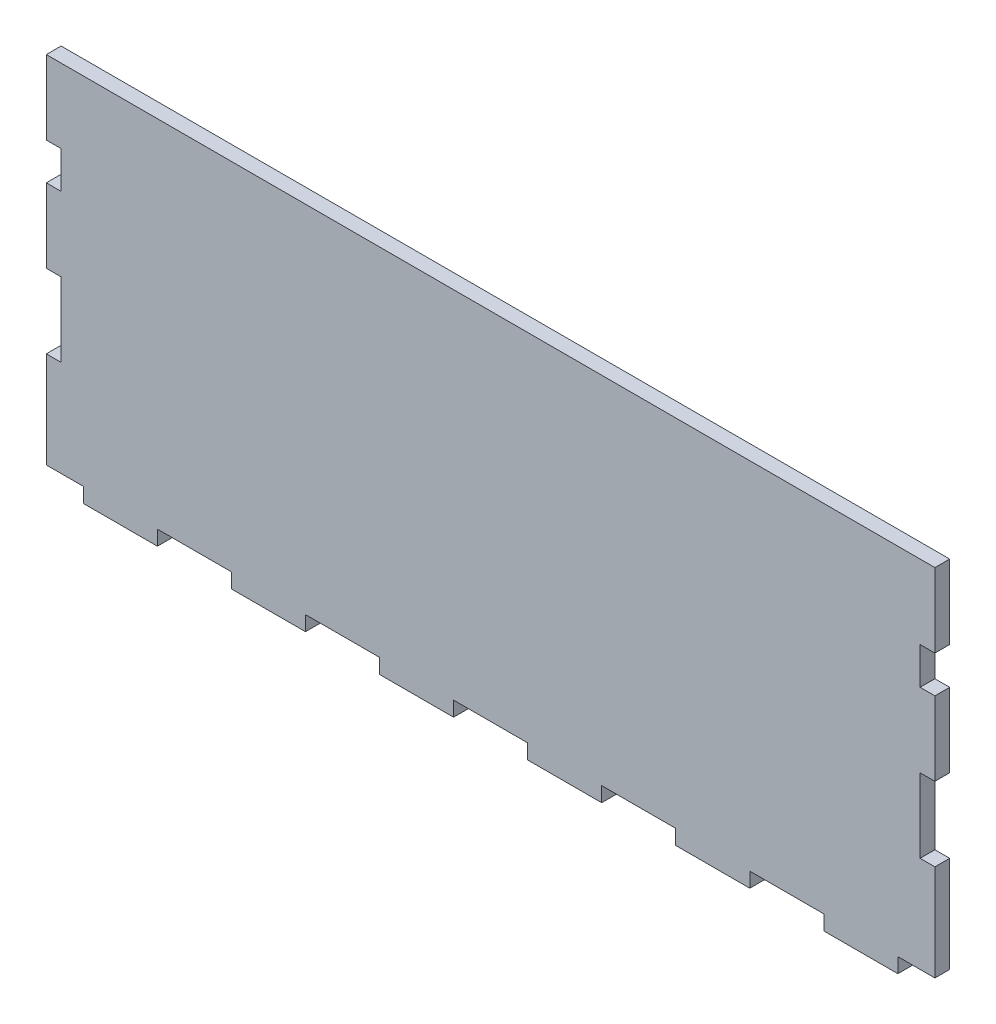
from build123d import *

# Parameters (mm, degrees)
BOSS_EXTRUDE1_DEPTH = 2.54


with BuildPart() as part:
    # Sketch1 → Boss-Extrude1 (new, symmetric)
    with BuildSketch(Plane.XY):
        Polygon((-152.4, 0), (-152.4, -25.4), (-147.32, -25.4), (-147.32, -38.1), (-152.4, -38.1), (-152.4, -63.5), (-147.32, -63.5), (-147.32, -88.9), (-152.4, -88.9), (-152.4, -121.92), (-139.7, -121.92), (-139.7, -127), (-114.3, -127), (-114.3, -121.92), (-88.9, -121.92), (-88.9, -127), (-63.5, -127), (-63.5, -121.92), (-38.1, -121.92), (-38.1, -127), (-12.7, -127), (-12.7, -121.92), (12.7, -121.92), (12.7, -127), (38.1, -127), (38.1, -121.92), (63.5, -121.92), (63.5, -127), (88.9, -127), (88.9, -121.92), (114.3, -121.92), (114.3, -127), (139.7, -127), (139.7, -121.92), (152.4, -121.92), (152.4, -88.9), (147.32, -88.9), (147.32, -63.5), (152.4, -63.5), (152.4, -38.1), (147.32, -38.1), (147.32, -25.4), (152.4, -25.4), (152.4, 0), align=None)
    extrude(amount=BOSS_EXTRUDE1_DEPTH, both=True)


solid = part.part
